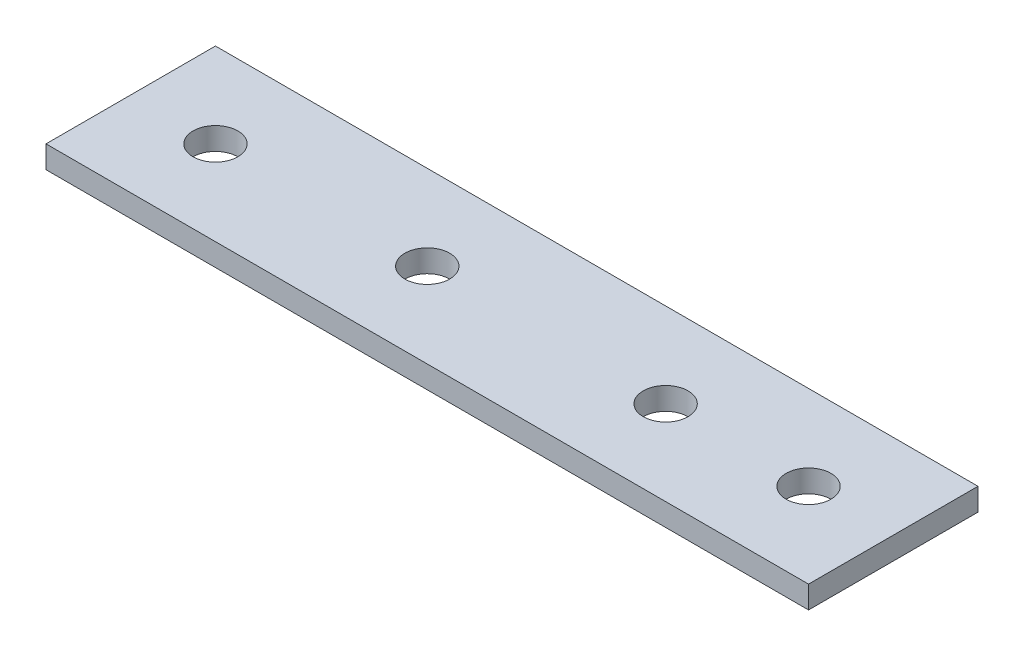
from build123d import *

# Parameters (mm, degrees)
SKETCH1_W           = 54
SKETCH1_H           = 12
SKETCH1_R           = 1.5875
BOSS_EXTRUDE1_DEPTH = 0.79375


with BuildPart() as part:
    # Sketch1 → Boss-Extrude1 (new, symmetric)
    with BuildSketch(Plane(origin=(0, 0, 0), x_dir=(1, 0, 0), z_dir=(0, 1, 0))):
        Rectangle(SKETCH1_W, SKETCH1_H)
        with Locations((-21, 0)):
            Circle(SKETCH1_R, mode=Mode.SUBTRACT)
        with Locations((21, 0)):
            Circle(SKETCH1_R, mode=Mode.SUBTRACT)
        with Locations((-6, 0)):
            Circle(SKETCH1_R, mode=Mode.SUBTRACT)
        with Locations((10.88, 0)):
            Circle(SKETCH1_R, mode=Mode.SUBTRACT)
    extrude(amount=BOSS_EXTRUDE1_DEPTH, both=True)


solid = part.part
